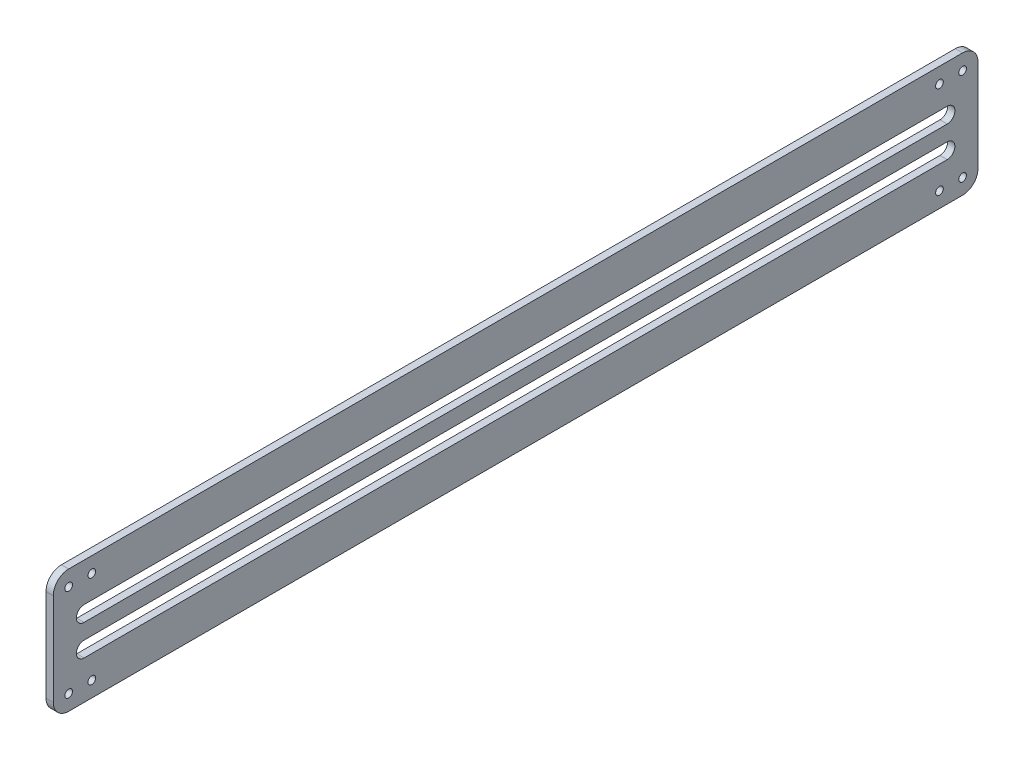
from build123d import *

# Parameters (mm, degrees)
OUTER_CUT_DEPTH   = 1.4986
SLOTS_DEPTH       = 193.209243294
SKETCH3_R         = 1.5875
MOUNT_HOLES_DEPTH = 193.209243294


with BuildPart() as part:
    # Sketch1 → Outer Cut (new, symmetric)
    with BuildSketch(Plane(origin=(0, 0, 0), x_dir=(0, 0, -1), z_dir=(1, 0, 0))):
        with BuildLine():
            Line((-184.15, -25.4), (184.15, -25.4))
            ThreePointArc((184.15, -25.4), (188.640128061, -23.540128061), (190.5, -19.05))
            Line((190.5, -19.05), (190.5, 19.05))
            ThreePointArc((190.5, 19.05), (188.640128061, 23.540128061), (184.15, 25.4))
            Line((184.15, 25.4), (-184.15, 25.4))
            ThreePointArc((-184.15, 25.4), (-188.640128061, 23.540128061), (-190.5, 19.05))
            Line((-190.5, 19.05), (-190.5, -19.05))
            ThreePointArc((-190.5, -19.05), (-188.640128061, -23.540128061), (-184.15, -25.4))
        make_face()
    extrude(amount=OUTER_CUT_DEPTH, both=True)

    # Sketch2 → Slots (cut, through all)
    with BuildSketch(Plane(origin=(1.4986, 0, 0), x_dir=(0, 0, -1), z_dir=(1, 0, 0))):
        with BuildLine():
            Line((-177.8, 9.525), (177.8, 9.525))
            ThreePointArc((177.8, 9.525), (180.975, 6.35), (177.8, 3.175))
            Line((177.8, 3.175), (-177.8, 3.175))
            ThreePointArc((-177.8, 3.175), (-180.975, 6.35), (-177.8, 9.525))
        make_face()
        with BuildLine():
            Line((-177.8, -9.525), (177.8, -9.525))
            ThreePointArc((177.8, -9.525), (180.975, -6.35), (177.8, -3.175))
            Line((177.8, -3.175), (-177.8, -3.175))
            ThreePointArc((-177.8, -3.175), (-180.975, -6.35), (-177.8, -9.525))
        make_face()
    extrude(amount=-SLOTS_DEPTH, mode=Mode.SUBTRACT)

    # Sketch3 → Mount Holes (cut, through all)
    with BuildSketch(Plane(origin=(1.4986, 0, 0), x_dir=(0, 0, -1), z_dir=(1, 0, 0))):
        with Locations((-184.15, 19.05)):
            Circle(SKETCH3_R)
        with Locations((-174.625, 19.05)):
            Circle(SKETCH3_R)
        with Locations((-174.625, -19.05)):
            Circle(SKETCH3_R)
        with Locations((-184.15, -19.05)):
            Circle(SKETCH3_R)
        with Locations((174.625, 19.05)):
            Circle(SKETCH3_R)
        with Locations((184.15, 19.05)):
            Circle(SKETCH3_R)
        with Locations((184.15, -19.05)):
            Circle(SKETCH3_R)
        with Locations((174.625, -19.05)):
            Circle(SKETCH3_R)
    extrude(amount=-MOUNT_HOLES_DEPTH, mode=Mode.SUBTRACT)


solid = part.part
